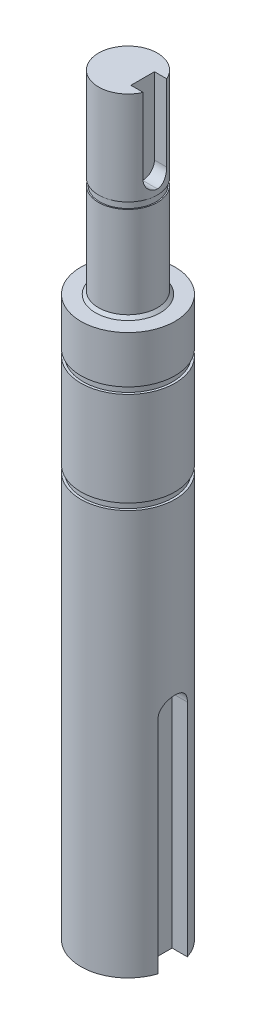
from build123d import *

# Parameters (mm, degrees)
SKETCH1_R               = 5
BOSS_EXTRUDE1_DEPTH     = 33
SKETCH2_R               = 8
BOSS_EXTRUDE2_DEPTH     = 95
CUT_EXTRUDE1_START      = -8
SKETCH3_OUTSIDE_W       = 43.996
SKETCH3_OUTSIDE_H       = 43.996
SKETCH3_OUTSIDE_R       = 7.6
CUT_EXTRUDE1_DEPTH      = 1.1
CUT_EXTRUDE2_START      = -25.1
SKETCH3_2_OUTSIDE_W     = 43.996
SKETCH3_2_OUTSIDE_H     = 43.996
SKETCH3_2_OUTSIDE_R     = 7.6
CUT_EXTRUDE2_DEPTH      = 1.1
CUT_EXTRUDE3_START      = 16
SKETCH4_OUTSIDE_W       = 43.996
SKETCH4_OUTSIDE_H       = 43.996
SKETCH4_OUTSIDE_R       = 4.8
CUT_EXTRUDE3_DEPTH      = 1.1
SKETCH5_R               = 2.1
CUT_EXTRUDE4_DEPTH      = 10
CUT_EXTRUDE5_START      = -15
CUT_EXTRUDE5_DEPTH      = 15
FILLET1_R               = 2
CUT_EXTRUDE6_DEPTH      = 129.499027333
CUT_EXTRUDE6_DEPTH_BACK = 40
FILLET2_R               = 2.5
CHAMFER1_SIZE           = 0.5


with BuildPart() as part:
    # Sketch1 → Boss-Extrude1 (new body)
    with BuildSketch(Plane(origin=(0, 0, 0), x_dir=(1, 0, 0), z_dir=(0, 1, 0))):
        with Locations(Location((0, 0, 0), (0, 0, 270))):
            Circle(SKETCH1_R)
    extrude(amount=BOSS_EXTRUDE1_DEPTH)

    # Sketch2 → Boss-Extrude2 (add)
    with BuildSketch(Plane.XZ):
        with Locations(Location((0, 0, 0), (0, 0, 270))):
            Circle(SKETCH2_R)
    extrude(amount=BOSS_EXTRUDE2_DEPTH)

    # Sketch3 outside → Cut-Extrude1 (cut)
    with BuildSketch(Plane(origin=(0, 0, 0), x_dir=(1, 0, 0), z_dir=(0, 1, 0)).offset(CUT_EXTRUDE1_START)):
        Rectangle(SKETCH3_OUTSIDE_W, SKETCH3_OUTSIDE_H)
        with Locations(Location((0, 0, 0), (0, 0, 270))):
            Circle(SKETCH3_OUTSIDE_R, mode=Mode.SUBTRACT)
    extrude(amount=-CUT_EXTRUDE1_DEPTH, mode=Mode.SUBTRACT)

    # Sketch3<2> outside → Cut-Extrude2 (cut)
    with BuildSketch(Plane(origin=(0, 0, 0), x_dir=(1, 0, 0), z_dir=(0, 1, 0)).offset(CUT_EXTRUDE2_START)):
        Rectangle(SKETCH3_2_OUTSIDE_W, SKETCH3_2_OUTSIDE_H)
        with Locations(Location((0, 0, 0), (0, 0, 270))):
            Circle(SKETCH3_2_OUTSIDE_R, mode=Mode.SUBTRACT)
    extrude(amount=-CUT_EXTRUDE2_DEPTH, mode=Mode.SUBTRACT)

    # Sketch4 outside → Cut-Extrude3 (cut)
    with BuildSketch(Plane(origin=(0, 0, 0), x_dir=(1, 0, 0), z_dir=(0, 1, 0)).offset(CUT_EXTRUDE3_START)):
        Rectangle(SKETCH4_OUTSIDE_W, SKETCH4_OUTSIDE_H)
        with Locations(Location((0, 0, 0), (0, 0, 270))):
            Circle(SKETCH4_OUTSIDE_R, mode=Mode.SUBTRACT)
    extrude(amount=CUT_EXTRUDE3_DEPTH, mode=Mode.SUBTRACT)

    # Sketch5 → Cut-Extrude4 (cut)
    with BuildSketch(Plane.XZ.offset(95)):
        with Locations(Location((0, 0, 0), (0, 0, 270))):
            Circle(SKETCH5_R)
    extrude(amount=-CUT_EXTRUDE4_DEPTH, mode=Mode.SUBTRACT)

    # Sketch6 → Cut-Extrude5 (cut)
    with BuildSketch(Plane(origin=(0, 33, 0), x_dir=(1, 0, 0), z_dir=(0, 1, 0)).offset(CUT_EXTRUDE5_START)):
        with BuildLine():
            Line((4.582575695, 2), (2.5, 2))
            Line((2.5, 2), (2.5, -2))
            Line((2.5, -2), (4.582575695, -2))
            ThreePointArc((4.582575695, -2), (5, 0), (4.582575695, 2))
        make_face()
    extrude(amount=CUT_EXTRUDE5_DEPTH, mode=Mode.SUBTRACT)

    # Fillet1
    fillet1_edges = [part.edges().sort_by_distance(p)[0] for p in [
        (3.541287847, 18, 2),
        (3.541287847, 18, -2),
    ]]
    fillet(fillet1_edges, radius=FILLET1_R - 0.0001)  # a hair under: the kernel refuses the full size

    # Sketch7 → Cut-Extrude6 (cut, two sides: drawn at the far end of the back side and taken through both)
    with BuildSketch(Plane.XZ.offset(95).offset(-CUT_EXTRUDE6_DEPTH_BACK)):
        Polygon((55.20729194, 2.5), (7.599342077, 2.5), (5, 2.5), (5, -2.5), (7.599342077, -2.5), (55.20729194, -2.5), (150.423191666, -2.5), (150.423191666, 2.5), align=None)
    extrude(amount=CUT_EXTRUDE6_DEPTH + CUT_EXTRUDE6_DEPTH_BACK, mode=Mode.SUBTRACT)

    # Fillet2
    fillet2_edges = [part.edges().sort_by_distance(p)[0] for p in [
        (6.299671038, -55, 2.5),
        (6.299671038, -55, -2.5),
    ]]
    fillet(fillet2_edges, radius=FILLET2_R - 0.0001)  # a hair under: the kernel refuses the full size

    # Chamfer1
    chamfer1_edges = [part.edges().sort_by_distance(p)[0] for p in [
        (0, 0, -5),
    ]]
    chamfer(chamfer1_edges, length=CHAMFER1_SIZE)


solid = part.part
